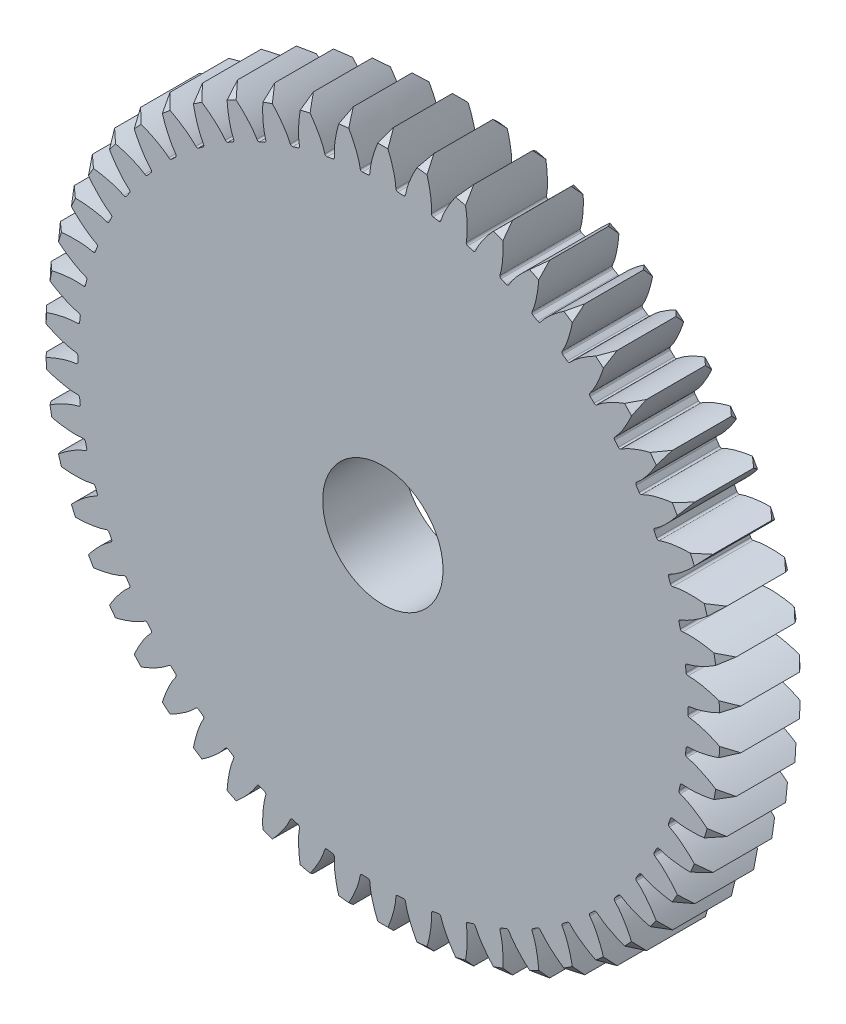
from build123d import *

# Parameters (mm, degrees)
SCHIZZO1_R                           = 87
SCHIZZO1_R_2                         = 15
ESTRUSIONE_ESTRUSIONE1_DEPTH         = 20
TAGLIO_ESTRUSIONE2_DEPTH             = 20
RACCORDO1_R                          = 0.5
SMUSSO1_SIZE                         = 3
RIPETIZIONECIRCOLARE1_COUNT          = 54
RACCORDO1_OF_RIPETIZIONECIRCOLARE1_R = 0.5


with BuildPart() as part:
    # Schizzo1 → Estrusione-Estrusione1 (new body)
    with BuildSketch(Plane.XY):
        Circle(SCHIZZO1_R)
        Circle(SCHIZZO1_R_2, mode=Mode.SUBTRACT)
    extrude(amount=ESTRUSIONE_ESTRUSIONE1_DEPTH)

    # Schizzo2 → Taglio-Estrusione2 (cut)
    with BuildSketch(Plane.XY.offset(20)):
        with BuildLine():
            ThreePointArc((75.991035187, 1.16729223), (76, 0), (75.991035187, -1.16729223))
            add(Edge.make_bspline(
                [(75.991035187, -1.16729223), (76.06330207, -1.168402315), (76.207688588, -1.173693957), (76.495874778, -1.19676348), (76.926179375, -1.250369862), (77.425245295, -1.333121804), (78.105422162, -1.473104421), (78.892159876, -1.669242206), (79.781513123, -1.931387694), (80.768869333, -2.2688209), (81.841995625, -2.681748218), (82.995924372, -3.178545658), (84.556479902, -3.92562321), (86.271149497, -4.86274571), (87.799620824, -5.803720746), (88.982145879, -6.602344037), (89.548208943, -7.000944553), (89.717777642, -7.121823848)],
                knots=[0, 0, 0, 0, 0, 0.000700508, 0.001401017, 0.002802034, 0.004203051, 0.005604068, 0.008132613, 0.010661158, 0.013189703, 0.015718248, 0.019278665, 0.022839082, 0.029959916, 0.034653354, 0.036672445, 0.036672445, 0.036672445, 0.036672445, 0.036672445], degree=4))
            ThreePointArc((89.717777642, -7.121823848), (90, 0), (89.717777642, 7.121823848))
            add(Edge.make_bspline(
                [(89.717777642, 7.121823848), (89.548208943, 7.000944553), (88.982145879, 6.602344037), (87.799620824, 5.803720746), (86.271149497, 4.86274571), (84.556479902, 3.92562321), (82.995924372, 3.178545658), (81.841995625, 2.681748218), (80.768869333, 2.2688209), (79.781513123, 1.931387694), (78.892159876, 1.669242206), (78.105422162, 1.473104421), (77.425245295, 1.333121804), (76.926179375, 1.250369862), (76.495874778, 1.19676348), (76.207688588, 1.173693957), (76.06330207, 1.168402315), (75.991035187, 1.16729223)],
                knots=[0.028328154, 0.028328154, 0.028328154, 0.028328154, 0.028328154, 0.030347245, 0.035040682, 0.042161516, 0.045721933, 0.04928235, 0.051810895, 0.05433944, 0.056867985, 0.059396531, 0.060797548, 0.062198565, 0.063599581, 0.06430009, 0.065000598, 0.065000598, 0.065000598, 0.065000598, 0.065000598], degree=4))
        make_face()
    taglio_estrusione2 = extrude(amount=-TAGLIO_ESTRUSIONE2_DEPTH, mode=Mode.SUBTRACT)

    # Raccordo1
    raccordo1_edges = [part.edges().sort_by_distance(p)[0] for p in [
        (75.991035187, -1.16729223, 10),
        (75.991035187, 1.16729223, 10),
    ]]
    fillet(raccordo1_edges, radius=RACCORDO1_R)

    # Smusso1
    smusso1_edges = [part.edges().sort_by_distance(p)[0] for p in [
        (-87, 0, 0),
        (-87, 0, 20),
    ]]
    chamfer(smusso1_edges, length=SMUSSO1_SIZE)

    # RipetizioneCircolare1: Taglio-Estrusione2 ×54 about axis
    ripetizionecircolare1_axis = Axis((0, 0, 20), (0, 0, -1))
    for i in range(1, RIPETIZIONECIRCOLARE1_COUNT):
        add(taglio_estrusione2.rotate(ripetizionecircolare1_axis, i * 360 / RIPETIZIONECIRCOLARE1_COUNT), mode=Mode.SUBTRACT)

    # Raccordo1 of RipetizioneCircolare1
    raccordo1_of_ripetizionecircolare1_edges = [part.edges().sort_by_distance(p)[0] for p in [
        (75.341696636, -9.981420139, 10),
        (75.612725349, -7.662621305, 10),
        (73.673490885, -18.660566465, 10),
        (74.211883113, -16.388911032, 10),
        (71.008977556, -27.087360641, 10),
        (71.807452467, -24.893568852, 10),
        (67.38418962, -35.147844732, 10),
        (68.431949211, -33.061583857, 10),
        (62.848146115, -42.733014519, 10),
        (64.131021236, -40.782497658, 10),
        (57.46218925, -49.740293592, 10),
        (58.962831214, -47.95189814, 10),
        (51.29915485, -56.074920523, 10),
        (52.99727005, -54.47283146, 10),
        (44.442387384, -61.651230349, 10),
        (46.315011725, -60.257113181, 10),
        (36.984612869, -66.393813047, 10),
        (39.006422318, -65.226520817, 10),
        (29.026684911, -70.238533321, 10),
        (31.170337965, -69.313851654, 10),
        (20.676220835, -73.133397924, 10),
        (22.912728263, -72.463831555, 10),
        (12.046146342, -75.03925878, 10),
        (14.345263217, -74.633862443, 10),
        (3.253168384, -75.93034239, 10),
        (5.583803096, -75.794598376, 10),
        (-5.583803096, -75.794598376, 10),
        (-3.253168384, -75.93034239, 10),
        (-14.345263217, -74.633862443, 10),
        (-12.046146342, -75.03925878, 10),
        (-22.912728263, -72.463831555, 10),
        (-20.676220835, -73.133397924, 10),
        (-31.170337965, -69.313851654, 10),
        (-29.026684911, -70.238533321, 10),
        (-39.006422318, -65.226520817, 10),
        (-36.984612869, -66.393813047, 10),
        (-46.315011725, -60.257113181, 10),
        (-44.442387384, -61.651230349, 10),
        (-52.99727005, -54.47283146, 10),
        (-51.29915485, -56.074920523, 10),
        (-58.962831214, -47.95189814, 10),
        (-57.46218925, -49.740293592, 10),
        (-64.131021236, -40.782497658, 10),
        (-62.848146115, -42.733014519, 10),
        (-68.431949211, -33.061583857, 10),
        (-67.38418962, -35.147844732, 10),
        (-71.807452467, -24.893568852, 10),
        (-71.008977556, -27.087360641, 10),
        (-74.211883113, -16.388911032, 10),
        (-73.673490885, -18.660566465, 10),
        (-75.612725349, -7.662621305, 10),
        (-75.341696636, -9.981420139, 10),
        (-75.991035187, 1.16729223, 10),
        (-75.991035187, -1.16729223, 10),
        (-75.341696636, 9.981420139, 10),
        (-75.612725349, 7.662621305, 10),
        (-73.673490885, 18.660566465, 10),
        (-74.211883113, 16.388911032, 10),
        (-71.008977556, 27.087360641, 10),
        (-71.807452467, 24.893568852, 10),
        (-67.38418962, 35.147844732, 10),
        (-68.431949211, 33.061583857, 10),
        (-62.848146115, 42.733014519, 10),
        (-64.131021236, 40.782497658, 10),
        (-57.46218925, 49.740293592, 10),
        (-58.962831214, 47.95189814, 10),
        (-51.29915485, 56.074920523, 10),
        (-52.99727005, 54.47283146, 10),
        (-44.442387384, 61.651230349, 10),
        (-46.315011725, 60.257113181, 10),
        (-36.984612869, 66.393813047, 10),
        (-39.006422318, 65.226520817, 10),
        (-29.026684911, 70.238533321, 10),
        (-31.170337965, 69.313851654, 10),
        (-20.676220835, 73.133397924, 10),
        (-22.912728263, 72.463831555, 10),
        (-12.046146342, 75.03925878, 10),
        (-14.345263217, 74.633862443, 10),
        (-3.253168384, 75.93034239, 10),
        (-5.583803096, 75.794598376, 10),
        (5.583803096, 75.794598376, 10),
        (3.253168384, 75.93034239, 10),
        (14.345263217, 74.633862443, 10),
        (12.046146342, 75.03925878, 10),
        (22.912728263, 72.463831555, 10),
        (20.676220835, 73.133397924, 10),
        (31.170337965, 69.313851654, 10),
        (29.026684911, 70.238533321, 10),
        (39.006422318, 65.226520817, 10),
        (36.984612869, 66.393813047, 10),
        (46.315011725, 60.257113181, 10),
        (44.442387384, 61.651230349, 10),
        (52.99727005, 54.47283146, 10),
        (51.29915485, 56.074920523, 10),
        (58.962831214, 47.95189814, 10),
        (57.46218925, 49.740293592, 10),
        (64.131021236, 40.782497658, 10),
        (62.848146115, 42.733014519, 10),
        (68.431949211, 33.061583857, 10),
        (67.38418962, 35.147844732, 10),
        (71.807452467, 24.893568852, 10),
        (71.008977556, 27.087360641, 10),
        (74.211883113, 16.388911032, 10),
        (73.673490885, 18.660566465, 10),
        (75.612725349, 7.662621305, 10),
        (75.341696636, 9.981420139, 10),
    ]]
    fillet(raccordo1_of_ripetizionecircolare1_edges, radius=RACCORDO1_OF_RIPETIZIONECIRCOLARE1_R)


solid = part.part
